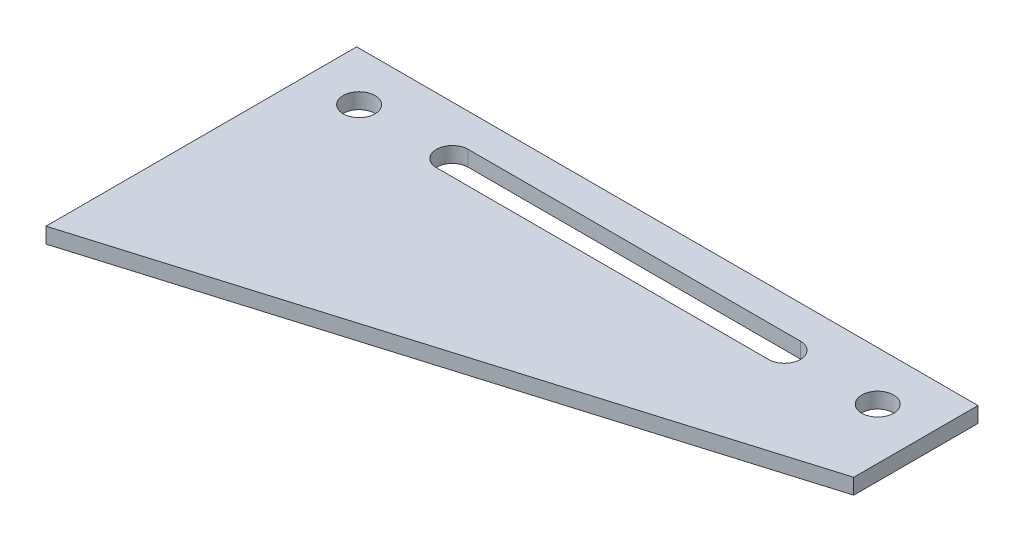
from build123d import *

# Parameters (mm, degrees)
SKETCH1_W           = 127
SKETCH1_H           = 127
BOSS_EXTRUDE1_DEPTH = 3.175
SKETCH2_R           = 3.25
CUT_EXTRUDE1_DEPTH  = 110.295656936


with BuildPart() as part:
    # Sketch1 → Boss-Extrude1 (new body)
    with BuildSketch(Plane(origin=(0, 0, 0), x_dir=(1, 0, 0), z_dir=(0, 1, 0))):
        with Locations((0, -25.4)):
            Rectangle(SKETCH1_W, SKETCH1_H)
    extrude(amount=BOSS_EXTRUDE1_DEPTH)

    # Sketch2 → Cut-Extrude1 (cut, through all)
    with BuildSketch(Plane(origin=(0, 3.175, 0), x_dir=(1, 0, 0), z_dir=(0, 1, 0))):
        Polygon((63.5, 12.7), (-63.5, -25.4), (-63.5, -88.9), (63.5, -88.9), align=None)
        with BuildLine():
            Line((33.95, 31.35), (-33.95, 31.35))
            ThreePointArc((-33.95, 31.35), (-37.2, 28.1), (-33.95, 24.85))
            Line((-33.95, 24.85), (33.95, 24.85))
            ThreePointArc((33.95, 24.85), (37.2, 28.1), (33.95, 31.35))
        make_face()
        with Locations((53, 28.1)):
            Circle(SKETCH2_R)
        with Locations((-53, 28.1)):
            Circle(SKETCH2_R)
    extrude(amount=-CUT_EXTRUDE1_DEPTH, mode=Mode.SUBTRACT)


solid = part.part
